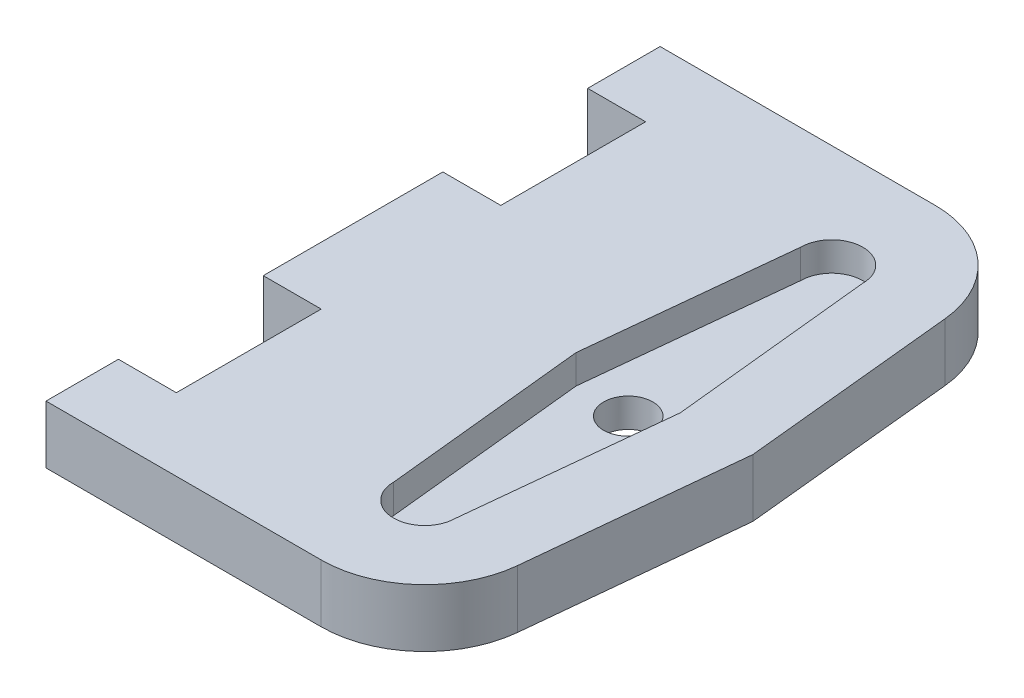
from build123d import *

# Parameters (mm, degrees)
SKETCH1_W               = 20
SKETCH1_H               = 50
BOSS_EXTRUDE2_DEPTH     = 4
CUT_EXTRUDE1_DEPTH      = 2
CUT_EXTRUDE2_DEPTH      = 55
CUT_EXTRUDE2_DEPTH_BACK = 55
SKETCH8_W               = 64.236712081
SKETCH8_H               = 42.4
BOSS_EXTRUDE4_DEPTH     = 4
SKETCH9_R               = 1.7
CUT_EXTRUDE4_DEPTH      = 4
CUT_EXTRUDE5_START      = -4
SKETCH10_R              = 1.7
SKETCH10_W              = 53.236712081
SKETCH10_H              = 42.4
CUT_EXTRUDE5_DEPTH      = 4
SKETCH11_W              = 6
SKETCH11_H              = 42.4
BOSS_EXTRUDE5_DEPTH     = 62.2
SKETCH13_W              = 42.4
SKETCH13_H              = 4
BOSS_EXTRUDE6_DEPTH     = 30
SKETCH14_R              = 5
CUT_EXTRUDE6_DEPTH      = 30
CUT_EXTRUDE7_DEPTH      = 78.888381675
CUT_EXTRUDE7_DEPTH_BACK = 78.888381675
SKETCH15_W              = 2
SKETCH15_H              = 66.2
CUT_EXTRUDE8_DEPTH      = 82.414249367
CUT_EXTRUDE8_DEPTH_BACK = 82.414249367
CUT_EXTRUDE9_DEPTH      = 78.888381675
CUT_EXTRUDE9_DEPTH_BACK = 78.888381675
SKETCH17_W              = 36.203088739
SKETCH17_H              = 88.054487652
SKETCH18_W              = 10
SKETCH18_H              = 4
CUT_EXTRUDE10_DEPTH     = 4


with BuildPart() as part:
    # Sketch1 → Boss-Extrude2 (new body)
    with BuildSketch(Plane(origin=(0, 0, 0), x_dir=(1, 0, 0), z_dir=(0, 1, 0))):
        with Locations((10, 25)):
            Rectangle(SKETCH1_W, SKETCH1_H)
    extrude(amount=BOSS_EXTRUDE2_DEPTH)

    # Sketch3 → Cut-Extrude1 (cut)
    with BuildSketch(Plane(origin=(0, 4, 0), x_dir=(1, 0, 0), z_dir=(0, 1, 0))):
        with BuildLine():
            Line((7.85, 10.95), (6.4, 25))
            Line((6.4, 25), (7.85, 39.05))
            ThreePointArc((7.85, 39.05), (10, 41.2), (12.15, 39.05))
            Line((12.15, 39.05), (13.6, 25))
            Line((13.6, 25), (12.15, 10.95))
            ThreePointArc((12.15, 10.95), (10, 8.8), (7.85, 10.95))
        make_face()
    extrude(amount=-CUT_EXTRUDE1_DEPTH, mode=Mode.SUBTRACT)

    # Sketch7 → Cut-Extrude2 (cut, two sides: drawn at the far end of the back side and taken through both)
    with BuildSketch(Plane(origin=(0, 4, 0), x_dir=(1, 0, 0), z_dir=(0, 1, 0)).offset(-CUT_EXTRUDE2_DEPTH_BACK)):
        with BuildLine():
            Line((17.114068962, 39.76590698), (18.6, 25))
            Line((18.6, 25), (17.114068962, 10.23409302))
            ThreePointArc((17.114068962, 10.23409302), (14.796027788, 5.647112348), (10, 3.8))
            Line((10, 3.8), (0, 3.8))
            Line((0, 3.8), (0, 0))
            Line((0, 0), (20, 0))
            Line((20, 0), (20, 50))
            Line((20, 50), (0, 50))
            Line((0, 50), (0, 46.2))
            Line((0, 46.2), (10, 46.2))
            ThreePointArc((10, 46.2), (14.796027788, 44.352887652), (17.114068962, 39.76590698))
        make_face()
    extrude(amount=CUT_EXTRUDE2_DEPTH + CUT_EXTRUDE2_DEPTH_BACK, mode=Mode.SUBTRACT)

    # Sketch8 → Boss-Extrude4 (add)
    with BuildSketch(Plane.XZ):
        with Locations((-32.118356041, -25)):
            Rectangle(SKETCH8_W, SKETCH8_H)
    extrude(amount=-BOSS_EXTRUDE4_DEPTH)

    # Sketch9 → Cut-Extrude4 (cut)
    with BuildSketch(Plane(origin=(0, 2, 0), x_dir=(1, 0, 0), z_dir=(0, 1, 0))):
        with Locations((10, 25)):
            Circle(SKETCH9_R)
    extrude(amount=-CUT_EXTRUDE4_DEPTH, mode=Mode.SUBTRACT)

    # Sketch10 → Cut-Extrude5 (cut)
    with BuildSketch(Plane.XZ.offset(CUT_EXTRUDE5_START)):
        with Locations((10, -25)):
            Circle(SKETCH10_R)
        with Locations((-37.618356041, -25)):
            Rectangle(SKETCH10_W, SKETCH10_H)
    extrude(amount=CUT_EXTRUDE5_DEPTH, mode=Mode.SUBTRACT)

    # Sketch11 → Boss-Extrude5 (add)
    with BuildSketch(Plane.XZ):
        with Locations((-8, -25)):
            Rectangle(SKETCH11_W, SKETCH11_H)
    extrude(amount=BOSS_EXTRUDE5_DEPTH)

    # Sketch13 → Boss-Extrude6 (add)
    with BuildSketch(Plane(origin=(-5, 0, 0), x_dir=(0, 0, -1), z_dir=(1, 0, 0))):
        with Locations((25, -60.2)):
            Rectangle(SKETCH13_W, SKETCH13_H)
    extrude(amount=BOSS_EXTRUDE6_DEPTH)

    # Sketch14 → Cut-Extrude6 (cut)
    with BuildSketch(Plane(origin=(0, -58.2, 0), x_dir=(1, 0, 0), z_dir=(0, 1, 0))):
        with BuildLine():
            Line((15.30974635, 16.526122865), (-5, 3.8))
            Line((-5, 3.8), (25, 3.8))
            Line((25, 3.8), (25, 46.2))
            Line((25, 46.2), (-5, 46.2))
            Line((-5, 46.2), (15.30974635, 33.473877135))
            ThreePointArc((15.30974635, 33.473877135), (20, 25), (15.30974635, 16.526122865))
        make_face()
        with Locations((10, 25)):
            Circle(SKETCH14_R)
    extrude(amount=-CUT_EXTRUDE6_DEPTH, mode=Mode.SUBTRACT)

    # Sketch15 → Cut-Extrude7 (cut, two sides: drawn at the far end of the back side and taken through both)
    with BuildSketch(Plane.XY.offset(-3.8).offset(-CUT_EXTRUDE7_DEPTH_BACK)):
        with Locations((-10, -29.1)):
            Rectangle(SKETCH15_W, SKETCH15_H)
    extrude(amount=CUT_EXTRUDE7_DEPTH + CUT_EXTRUDE7_DEPTH_BACK, mode=Mode.SUBTRACT)

    # Sketch16 → Cut-Extrude8 (cut, two sides: drawn at the far end of the back side and taken through both)
    with BuildSketch(Plane(origin=(-5, 0, 0), x_dir=(0, 0, -1), z_dir=(1, 0, 0)).offset(-CUT_EXTRUDE8_DEPTH_BACK)):
        Polygon((3.8, 0), (10, -19.1), (20, -19.1), (20, -39.1), (10, -39.1), (3.8, -58.2), align=None)
        Polygon((46.2, -58.2), (40, -39.1), (30, -39.1), (30, -19.1), (40, -19.1), (46.2, 0), align=None)
    extrude(amount=CUT_EXTRUDE8_DEPTH + CUT_EXTRUDE8_DEPTH_BACK, mode=Mode.SUBTRACT)

    # Sketch17 → Cut-Extrude9 (cut, two sides: drawn at the far end of the back side and taken through both)
    with BuildSketch(Plane.XY.offset(-3.8).offset(-CUT_EXTRUDE9_DEPTH_BACK)):
        with Locations((9.10154437, -44.027243826)):
            Rectangle(SKETCH17_W, SKETCH17_H)
    extrude(amount=CUT_EXTRUDE9_DEPTH + CUT_EXTRUDE9_DEPTH_BACK, mode=Mode.SUBTRACT)

    # Sketch18 → Cut-Extrude10 (cut)
    with BuildSketch(Plane.ZY.offset(9)):
        with Locations((-13.8, 2)):
            Rectangle(SKETCH18_W, SKETCH18_H)
        with Locations((-36.2, 2)):
            Rectangle(SKETCH18_W, SKETCH18_H)
    extrude(amount=-CUT_EXTRUDE10_DEPTH, mode=Mode.SUBTRACT)


solid = part.part
